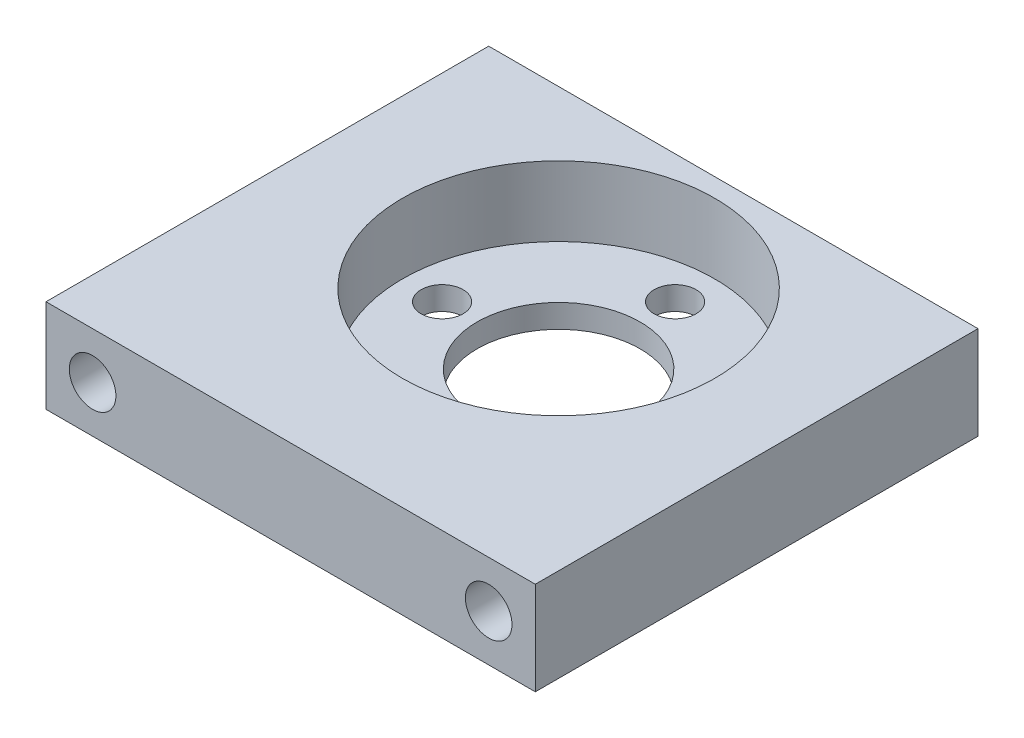
from build123d import *

# Parameters (mm, degrees)
ESQUISSE1_W             = 42
ESQUISSE1_H             = 46
BOSS_EXTRU_1_DEPTH      = 8
ESQUISSE2_R             = 13.4
ENL_V_MAT_EXTRU_1_DEPTH = 6
ESQUISSE3_R             = 7
ESQUISSE3_R_2           = 1.8
ENL_V_MAT_EXTRU_2_DEPTH = 63.577951389
ESQUISSE4_R             = 2
ENL_V_MAT_EXTRU_3_DEPTH = 63.801273872
ENL_V_MAT_EXTRU_4_REACH = 64.801
ESQUISSE5_W             = 42
ESQUISSE5_H             = 8


with BuildPart() as part:
    # Esquisse1 → Boss.-Extru.1 (new body)
    with BuildSketch(Plane(origin=(0, 0, 0), x_dir=(1, 0, 0), z_dir=(0, 1, 0))):
        with Locations((21, 23)):
            Rectangle(ESQUISSE1_W, ESQUISSE1_H)
    extrude(amount=BOSS_EXTRU_1_DEPTH)

    # Esquisse2 → Enlèv. mat.-Extru.1 (cut)
    with BuildSketch(Plane(origin=(0, 8, 0), x_dir=(1, 0, 0), z_dir=(0, 1, 0))):
        with Locations((21, 23)):
            Circle(ESQUISSE2_R)
    extrude(amount=-ENL_V_MAT_EXTRU_1_DEPTH, mode=Mode.SUBTRACT)

    # Esquisse3 → Enlèv. mat.-Extru.2 (cut, through all)
    with BuildSketch(Plane(origin=(0, 2, 0), x_dir=(1, 0, 0), z_dir=(0, 1, 0))):
        with Locations((21, 23)):
            Circle(ESQUISSE3_R)
        with Locations((21, 33)):
            Circle(ESQUISSE3_R_2)
        with Locations((31, 23)):
            Circle(ESQUISSE3_R_2)
        with Locations((21, 13)):
            Circle(ESQUISSE3_R_2)
        with Locations((11, 23)):
            Circle(ESQUISSE3_R_2)
    extrude(amount=-ENL_V_MAT_EXTRU_2_DEPTH, mode=Mode.SUBTRACT)

    # Esquisse4 → Enlèv. mat.-Extru.3 (cut, through all)
    with BuildSketch(Plane(origin=(0, 0, -46), x_dir=(-1, 0, 0), z_dir=(0, 0, -1))):
        with Locations((-38, 4)):
            Circle(ESQUISSE4_R)
        with Locations((-4, 4)):
            Circle(ESQUISSE4_R)
    extrude(amount=-ENL_V_MAT_EXTRU_3_DEPTH, mode=Mode.SUBTRACT)

    # Esquisse5 → Enlèv. mat.-Extru.4 (cut, up to next)
    with BuildSketch(Plane(origin=(0, 8, 0), x_dir=(1, 0, 0), z_dir=(0, 1, 0)), mode=Mode.PRIVATE) as enl_v_mat_extru_4_sk1:
        with Locations((21, 42)):
            Rectangle(ESQUISSE5_W, ESQUISSE5_H)
    enl_v_mat_extru_4_tool1 = extrude(enl_v_mat_extru_4_sk1.sketch, amount=-ENL_V_MAT_EXTRU_4_REACH, mode=Mode.PRIVATE) & part.part
    add(enl_v_mat_extru_4_tool1.solids().sort_by_distance((21, 8, -42))[0], mode=Mode.SUBTRACT)


solid = part.part
